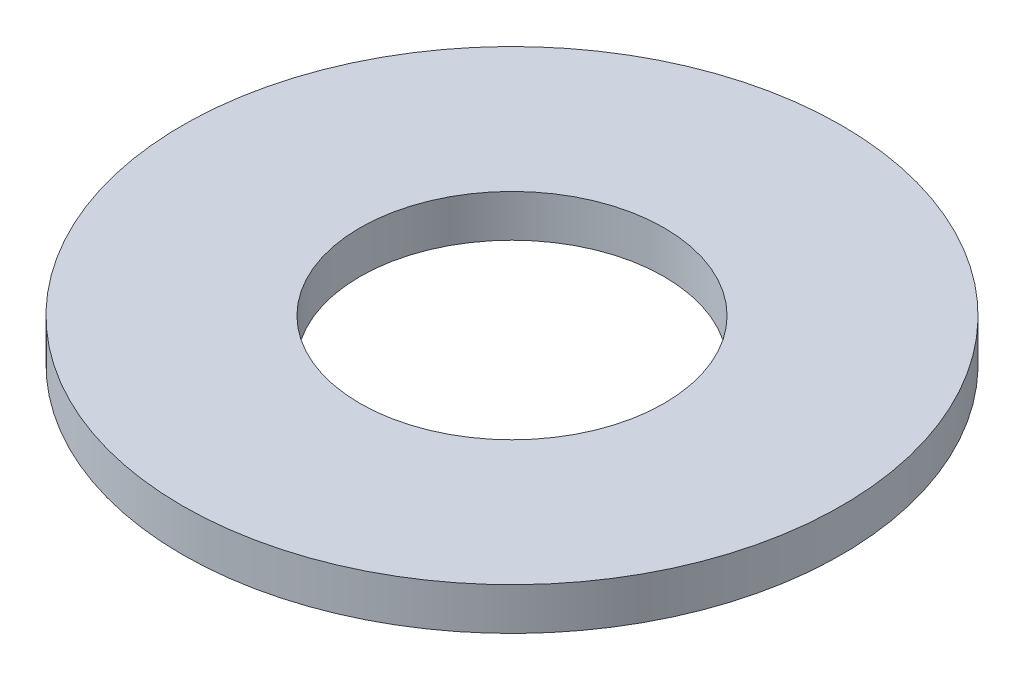
from build123d import *


with BuildPart() as part:
    # Sketch1 → Revolve1 (revolve)
    with BuildSketch(Plane.XY):
        Polygon((-18, 70), (-39, 70), (-39, 65), (-31, 65), (-31, 62), (-26, 62), (-26, 65), (-18, 65), align=None)
    revolve(axis=Axis((0, 0, 0), (0, -1, 0)))


solid = part.part
